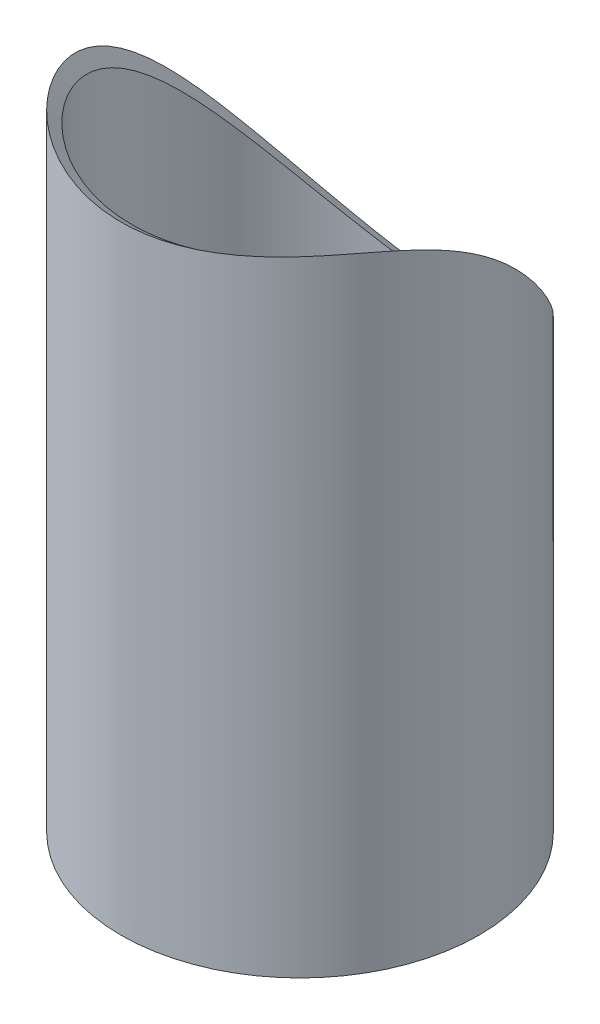
from build123d import *

# Parameters (mm, degrees)
EXTRUDE_1_OUTLINE_R      = 50
EXTRUDE_1_OUTLINE_R_2    = 47
EXTRUDE_1_DEPTH          = 200
CUT_EXTRUDE_1_DEPTH      = 213.132034356
CUT_EXTRUDE_1_DEPTH_BACK = 213.132034356
SKETCH_2_R               = 67.5


# Read off the part's stored shape, not the designer's step: Вытянуть-Тонкостенный1
with BuildPart() as part:
    # Вытянуть-Тонкостенный1 outline → Вытянуть-Тонкостенный1 (new body)
    with BuildSketch(Plane(origin=(0, 0, 0), x_dir=(1, 0, 0), z_dir=(0, 1, 0))):
        Circle(EXTRUDE_1_OUTLINE_R)
        Circle(EXTRUDE_1_OUTLINE_R_2, mode=Mode.SUBTRACT)
    extrude(amount=EXTRUDE_1_DEPTH)

    # Эскиз2 → Вырез-Вытянуть1 (cut, two sides: drawn at the far end of the back side and taken through both)
    with BuildSketch(Plane(origin=(0, 0, 0), x_dir=(1, 0, 0), z_dir=(0, -0.5735764363510444, -0.819152044288993)).offset(-CUT_EXTRUDE_1_DEPTH_BACK)):
        with Locations((0, -180)):
            Circle(SKETCH_2_R)
    extrude(amount=CUT_EXTRUDE_1_DEPTH + CUT_EXTRUDE_1_DEPTH_BACK, mode=Mode.SUBTRACT)


solid = part.part
